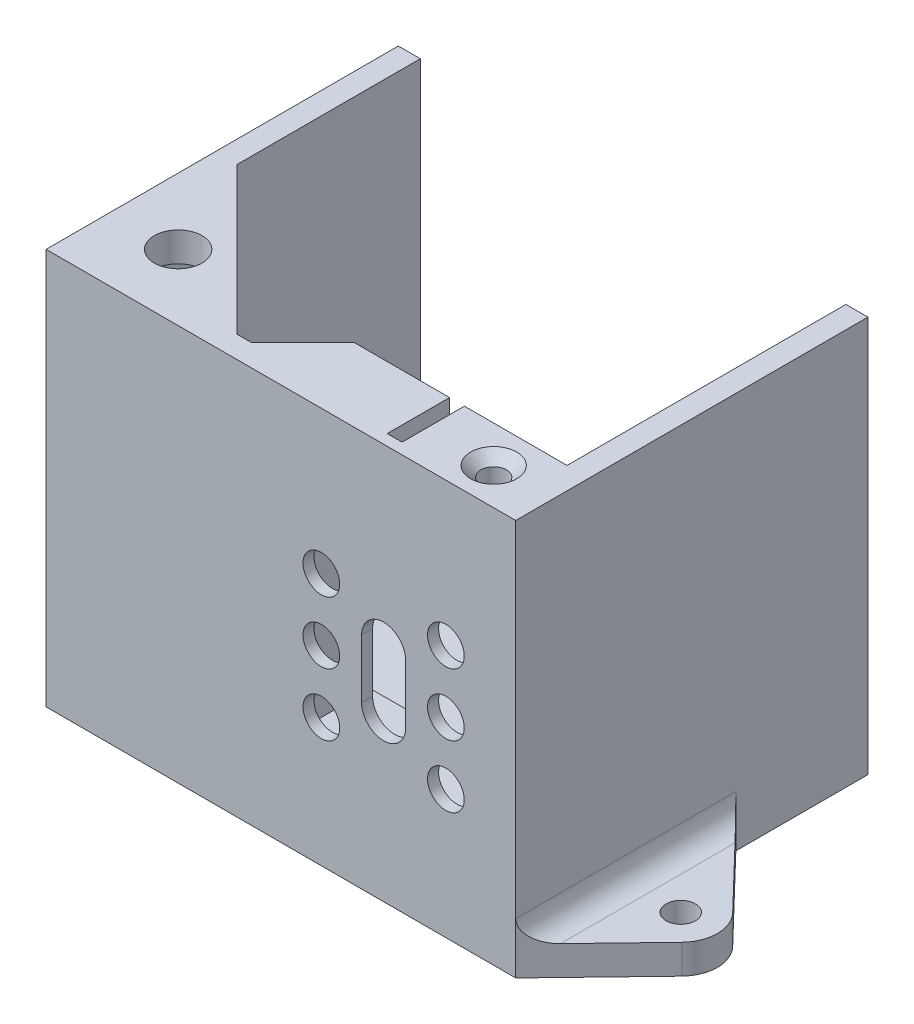
from build123d import *

# Parameters (mm, degrees)
SKETCH1_W                                           = 64
SKETCH1_H                                           = 48
BOSS_EXTRUDE1_DEPTH                                 = 4
CUT_EXTRUDE1_DEPTH                                  = 2.4
CUT_EXTRUDE2_DEPTH                                  = 2.4
BOSS_EXTRUDE3_DEPTH                                 = 50
BOSS_EXTRUDE4_DEPTH                                 = 50
CUT_EXTRUDE4_DEPTH                                  = 9.5
SKETCH13_W                                          = 36.946258726
SKETCH13_H                                          = 1
CUT_EXTRUDE6_DEPTH                                  = 32
SKETCH15_R                                          = 3.25
BOSS_EXTRUDE5_DEPTH                                 = 4
CUT_EXTRUDE7_DEPTH                                  = 7
SKETCH18_W                                          = 5.8
SKETCH18_H                                          = 2.6
CUT_EXTRUDE8_DEPTH                                  = 5
SKETCH19_R                                          = 1.75
BOSS_EXTRUDE8_DEPTH                                 = 4.4
FILLET1_R                                           = 1.5
SKETCH20_R                                          = 2
BOSS_EXTRUDE9_DEPTH                                 = 4
FILLET2_R                                           = 3
SKETCH22_R                                          = 1.75
CUT_EXTRUDE9_DEPTH                                  = 2
SKETCH23_R                                          = 2.5
CUT_EXTRUDE10_DEPTH                                 = 3
CSK_FOR_M3_COUNTERSUNK_FLAT_HEAD_SCREW1_D           = 3.2
CSK_FOR_M3_COUNTERSUNK_FLAT_HEAD_SCREW1_CSINK_D     = 6.3
CSK_FOR_M3_COUNTERSUNK_FLAT_HEAD_SCREW1_CSINK_ANGLE = 90


with BuildPart() as part:
    # Sketch1 → Boss-Extrude1 (new body)
    with BuildSketch(Plane(origin=(0, 0, 0), x_dir=(1, 0, 0), z_dir=(0, 1, 0))):
        Rectangle(SKETCH1_W, SKETCH1_H)
    extrude(amount=BOSS_EXTRUDE1_DEPTH)

    # Sketch2 → Cut-Extrude1 (cut)
    with BuildSketch(Plane.XZ):
        Polygon((-20.651368439, -16), (-22.325684219, -13.1), (-25.674315781, -13.1), (-27.348631561, -16), (-25.674315781, -18.9), (-22.325684219, -18.9), align=None)
    extrude(amount=-CUT_EXTRUDE1_DEPTH, mode=Mode.SUBTRACT)

    # Sketch4 → Cut-Extrude2 (cut)
    with BuildSketch(Plane.XZ):
        Polygon((9.348631561, 10), (7.674315781, 12.9), (4.325684219, 12.9), (2.651368439, 10), (4.325684219, 7.1), (7.674315781, 7.1), align=None)
    extrude(amount=-CUT_EXTRUDE2_DEPTH, mode=Mode.SUBTRACT)

    # Sketch6 → Boss-Extrude3 (add)
    with BuildSketch(Plane(origin=(0, 4, 0), x_dir=(1, 0, 0), z_dir=(0, 1, 0))):
        Polygon((-29, -21), (-29, 21), (-29, 24), (-32, 24), (-32, -24), (32, -24), (32, 24), (29, 24), (29, 21), (29, -21), align=None)
    extrude(amount=BOSS_EXTRUDE3_DEPTH)

    # Sketch9 → Boss-Extrude4 (add)
    with BuildSketch(Plane(origin=(0, 4, 0), x_dir=(1, 0, 0), z_dir=(0, 1, 0))):
        Polygon((29, -13), (1, -13), (-7, -21), (29, -21), align=None)
    extrude(amount=BOSS_EXTRUDE4_DEPTH)

    # Sketch10 → Cut-Extrude4 (cut)
    with BuildSketch(Plane(origin=(0, 0, 13), x_dir=(-1, 0, 0), z_dir=(0, 0, -1))):
        Polygon((-15.011861685, 38.75), (-26.75, 38.75), (-26.75, 13.25), (-1.25, 13.25), (-1.25, 38.75), (-12.988138315, 38.75), (-12.988138315, 54), (-15.011861685, 54), align=None)
    extrude(amount=-CUT_EXTRUDE4_DEPTH, mode=Mode.SUBTRACT)

    # Sketch13 → Cut-Extrude6 (cut)
    with BuildSketch(Plane(origin=(0, 54, 0), x_dir=(1, 0, 0), z_dir=(0, 1, 0))):
        with Locations((10.526870637, -13.5)):
            Rectangle(SKETCH13_W, SKETCH13_H)
    extrude(amount=-CUT_EXTRUDE6_DEPTH, mode=Mode.SUBTRACT)

    # Sketch15 → Boss-Extrude5 (add)
    with BuildSketch(Plane(origin=(0, 54, 0), x_dir=(1, 0, 0), z_dir=(0, 1, 0))):
        Polygon((-29, -1), (-9, -21), (-29, -21), align=None)
        with Locations((-23, -15)):
            Circle(SKETCH15_R, mode=Mode.SUBTRACT)
    extrude(amount=-BOSS_EXTRUDE5_DEPTH)

    # Sketch17 → Cut-Extrude7 (cut)
    with BuildSketch(Plane(origin=(0, 54, 0), x_dir=(1, 0, 0), z_dir=(0, 1, 0))):
        Polygon((24, -15.651368439), (21.1, -17.325684219), (21.1, -20.674315781), (24, -22.348631561), (26.9, -20.674315781), (26.9, -17.325684219), align=None)
    extrude(amount=-CUT_EXTRUDE7_DEPTH, mode=Mode.SUBTRACT)

    # Sketch18 → Cut-Extrude8 (cut)
    with BuildSketch(Plane(origin=(0, 0, 14), x_dir=(-1, 0, 0), z_dir=(0, 0, -1))):
        with Locations((-24, 48.3)):
            Rectangle(SKETCH18_W, SKETCH18_H)
    extrude(amount=-CUT_EXTRUDE8_DEPTH, mode=Mode.SUBTRACT)

    # Sketch19 → Boss-Extrude8 (add)
    with BuildSketch(Plane(origin=(0, 54, 0), x_dir=(1, 0, 0), z_dir=(0, 1, 0))):
        Polygon((26.9, -17.325684219), (24, -15.651368439), (21.1, -17.325684219), (21.1, -20.674315781), (24, -22.348631561), (26.9, -20.674315781), align=None)
        with Locations((24, -19)):
            Circle(SKETCH19_R, mode=Mode.SUBTRACT)
    extrude(amount=-BOSS_EXTRUDE8_DEPTH)

    # Fillet1
    fillet1_edges = [part.edges().sort_by_distance(p)[0] for p in [
        (-29, 50, 11),
        (-19, 50, 21),
    ]]
    fillet(fillet1_edges, radius=FILLET1_R)

    # Sketch20 → Boss-Extrude9 (add)
    # profile 1 of 2: a face of its own
    with BuildSketch(Plane.XZ):
        with BuildLine():
            Line((43.102082828, 12.467708073), (32.000000003, 23.999999995))
            Line((32.000000003, 23.999999995), (32, -6.000000006))
            Line((32, -6.000000006), (43.102082819, 5.532291906))
            ThreePointArc((43.102082819, 5.532291906), (44.500000003, 8.999999988), (43.102082828, 12.467708073))
        make_face()
        with Locations((39.500000002, 8.999999994)):
            Circle(SKETCH20_R, mode=Mode.SUBTRACT)
    # profile 2 of 2: a face of its own
    with BuildSketch(Plane.XZ):
        with BuildLine():
            Line((-32, -24), (-32, 2.000000002))
            Line((-32, 2.000000002), (-42.978939192, -7.408763151))
            ThreePointArc((-42.978939192, -7.408763151), (-44.499999999, -10.999999999), (-42.978939192, -14.591236846))
            Line((-42.978939192, -14.591236846), (-32, -24))
        make_face()
        with Locations((-39.499999999, -10.999999999)):
            Circle(SKETCH20_R, mode=Mode.SUBTRACT)
    extrude(amount=-BOSS_EXTRUDE9_DEPTH)

    # Fillet2
    fillet2_edges = [part.edges().sort_by_distance(p)[0] for p in [
        (-32, 4, -10.999999999),
        (32.000000002, 4, 8.999999995),
    ]]
    fillet(fillet2_edges, radius=FILLET2_R)

    # Sketch22 → Cut-Extrude9 (cut)
    with BuildSketch(Plane.XZ.offset(-2.4)):
        with Locations((-24, -16)):
            Circle(SKETCH22_R)
        with Locations((6, 10)):
            Circle(SKETCH22_R)
    extrude(amount=-CUT_EXTRUDE9_DEPTH, mode=Mode.SUBTRACT)

    # Sketch23 → Cut-Extrude10 (cut)
    with BuildSketch(Plane(origin=(0, 0, 22.5), x_dir=(-1, 0, 0), z_dir=(0, 0, -1))):
        with Locations((-22.485281374, 34.485281374)):
            Circle(SKETCH23_R)
        with Locations((-5.514718626, 34.485281374)):
            Circle(SKETCH23_R)
        with Locations((-5.514718626, 17.514718626)):
            Circle(SKETCH23_R)
        with Locations((-22.485281374, 17.514718626)):
            Circle(SKETCH23_R)
        with Locations((-22.485281374, 26)):
            Circle(SKETCH23_R)
        with Locations((-5.514718626, 26)):
            Circle(SKETCH23_R)
        with BuildLine():
            Line((-11, 30), (-11, 22))
            ThreePointArc((-11, 22), (-14, 19), (-17, 22))
            Line((-17, 22), (-17, 30))
            ThreePointArc((-17, 30), (-14, 33), (-11, 30))
        make_face()
    extrude(amount=-CUT_EXTRUDE10_DEPTH, mode=Mode.SUBTRACT)

    # CSK for M3 Countersunk Flat Head Screw1 (through all)
    with Locations(Plane(origin=(0, 54, 0), x_dir=(1, 0, 0), z_dir=(0, 1, 0))):
        with Locations((24, -19)):
            CounterSinkHole(CSK_FOR_M3_COUNTERSUNK_FLAT_HEAD_SCREW1_D / 2, CSK_FOR_M3_COUNTERSUNK_FLAT_HEAD_SCREW1_CSINK_D / 2, counter_sink_angle=CSK_FOR_M3_COUNTERSUNK_FLAT_HEAD_SCREW1_CSINK_ANGLE)


solid = part.part
